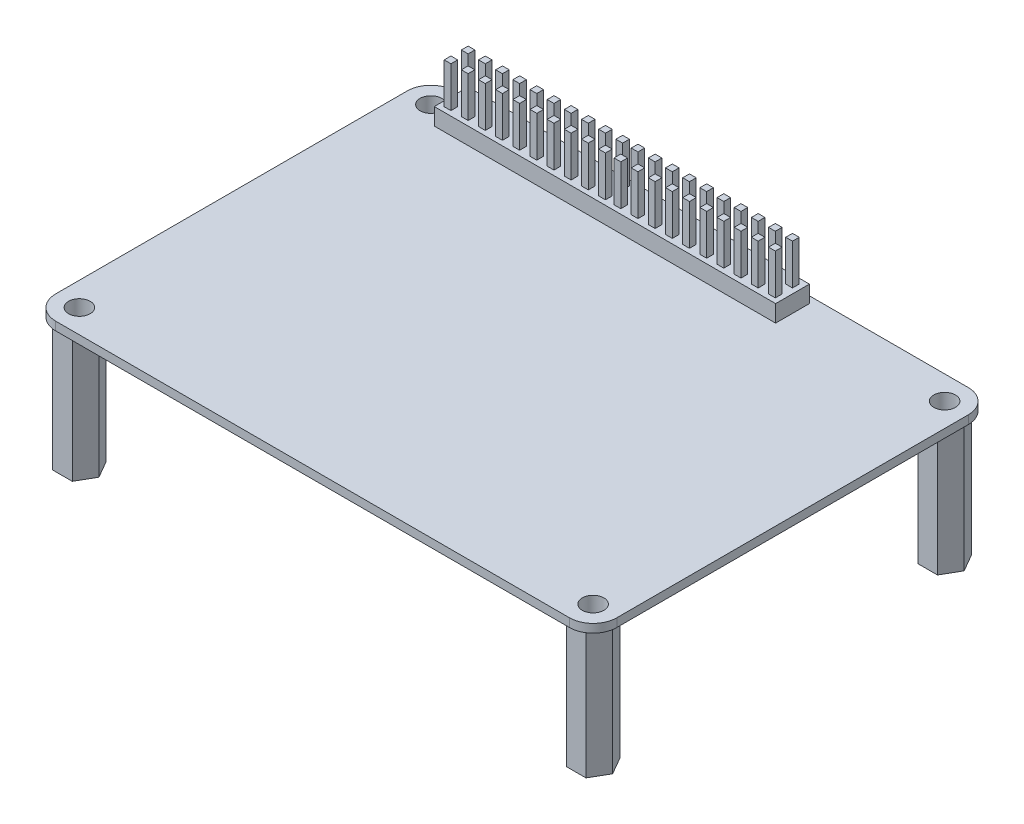
from build123d import *

# Parameters (mm, degrees)
ESQUISSE1_R        = 1.6
BOSS_EXTRU_1_DEPTH = 1.25
BOSS_EXTRU_2_START = 19.05
ESQUISSE2_R        = 1.6
BOSS_EXTRU_2_DEPTH = 19.05
ESQUISSE4_W        = 50.5
ESQUISSE4_H        = 5
BOSS_EXTRU_3_DEPTH = 2.5
ESQUISSE5_W        = 1
ESQUISSE5_H        = 1
BOSS_EXTRU_4_DEPTH = 6


with BuildPart() as part:
    # Esquisse1 → Boss.-Extru.1 (new body)
    with BuildSketch(Plane(origin=(0, 0, 0), x_dir=(1, 0, 0), z_dir=(0, 1, 0))):
        with BuildLine():
            Line((-38, -29.5), (38, -29.5))
            ThreePointArc((38, -29.5), (40.474873734, -28.474873734), (41.5, -26))
            Line((41.5, -26), (41.5, 26))
            ThreePointArc((41.5, 26), (40.474873734, 28.474873734), (38, 29.5))
            Line((38, 29.5), (-38, 29.5))
            ThreePointArc((-38, 29.5), (-40.474873734, 28.474873734), (-41.5, 26))
            Line((-41.5, 26), (-41.5, -26))
            ThreePointArc((-41.5, -26), (-40.474873734, -28.474873734), (-38, -29.5))
        make_face()
        with Locations((38, 26)):
            Circle(ESQUISSE1_R, mode=Mode.SUBTRACT)
        with Locations((38, -26)):
            Circle(ESQUISSE1_R, mode=Mode.SUBTRACT)
        with Locations((-38, 26)):
            Circle(ESQUISSE1_R, mode=Mode.SUBTRACT)
        with Locations((-38, -26)):
            Circle(ESQUISSE1_R, mode=Mode.SUBTRACT)
    extrude(amount=BOSS_EXTRU_1_DEPTH)

    # Esquisse2 → Boss.-Extru.2 (add)
    # profile 1 of 4: a face of its own
    with BuildSketch(Plane.XZ.offset(BOSS_EXTRU_2_START)):
        Polygon((-36.556624327, 28.5), (-39.443375673, 28.5), (-40.886751346, 26), (-39.443375673, 23.5), (-36.556624327, 23.5), (-35.113248654, 26), align=None)
        with Locations((-38, 26)):
            Circle(ESQUISSE2_R, mode=Mode.SUBTRACT)
    # profile 2 of 4: a face of its own
    with BuildSketch(Plane.XZ.offset(BOSS_EXTRU_2_START)):
        Polygon((-36.556624327, -23.5), (-39.443375673, -23.5), (-40.886751346, -26), (-39.443375673, -28.5), (-36.556624327, -28.5), (-35.113248654, -26), align=None)
        with Locations((-38, -26)):
            Circle(ESQUISSE2_R, mode=Mode.SUBTRACT)
    # profile 3 of 4: a face of its own
    with BuildSketch(Plane.XZ.offset(BOSS_EXTRU_2_START)):
        Polygon((39.443375673, -23.5), (36.556624327, -23.5), (35.113248654, -26), (36.556624327, -28.5), (39.443375673, -28.5), (40.886751346, -26), align=None)
        with Locations((38, -26)):
            Circle(ESQUISSE2_R, mode=Mode.SUBTRACT)
    # profile 4 of 4: a face of its own
    with BuildSketch(Plane.XZ.offset(BOSS_EXTRU_2_START)):
        Polygon((36.556624327, 23.5), (39.443375673, 23.5), (40.886751346, 26), (39.443375673, 28.5), (36.556624327, 28.5), (35.113248654, 26), align=None)
        with Locations((38, 26)):
            Circle(ESQUISSE2_R, mode=Mode.SUBTRACT)
    extrude(amount=-BOSS_EXTRU_2_DEPTH)

    # Esquisse4 → Boss.-Extru.3 (add)
    with BuildSketch(Plane(origin=(0, 1.25, 0), x_dir=(1, 0, 0), z_dir=(0, 1, 0))):
        with Locations((-9.75, 26)):
            Rectangle(ESQUISSE4_W, ESQUISSE4_H)
    extrude(amount=BOSS_EXTRU_3_DEPTH)

    # Esquisse5 → Boss.-Extru.4 (add)
    with BuildSketch(Plane(origin=(0, 3.75, 0), x_dir=(1, 0, 0), z_dir=(0, 1, 0))):
        with Locations((14.245, 27.25)):
            Rectangle(ESQUISSE5_W, ESQUISSE5_H)
        with Locations((-10.885, 27.25)):
            Rectangle(ESQUISSE5_W, ESQUISSE5_H)
        with Locations((-13.425, 27.25)):
            Rectangle(ESQUISSE5_W, ESQUISSE5_H)
        with Locations((-15.965, 27.25)):
            Rectangle(ESQUISSE5_W, ESQUISSE5_H)
        with Locations((-18.505, 27.25)):
            Rectangle(ESQUISSE5_W, ESQUISSE5_H)
        with Locations((-21.045, 27.25)):
            Rectangle(ESQUISSE5_W, ESQUISSE5_H)
        with Locations((-23.585, 27.25)):
            Rectangle(ESQUISSE5_W, ESQUISSE5_H)
        with Locations((-26.125, 27.25)):
            Rectangle(ESQUISSE5_W, ESQUISSE5_H)
        with Locations((-28.665, 27.25)):
            Rectangle(ESQUISSE5_W, ESQUISSE5_H)
        with Locations((-31.205, 27.25)):
            Rectangle(ESQUISSE5_W, ESQUISSE5_H)
        with Locations((-33.745, 27.25)):
            Rectangle(ESQUISSE5_W, ESQUISSE5_H)
        with Locations((11.705, 27.25)):
            Rectangle(ESQUISSE5_W, ESQUISSE5_H)
        with Locations((9.165, 27.25)):
            Rectangle(ESQUISSE5_W, ESQUISSE5_H)
        with Locations((6.625, 27.25)):
            Rectangle(ESQUISSE5_W, ESQUISSE5_H)
        with Locations((4.085, 27.25)):
            Rectangle(ESQUISSE5_W, ESQUISSE5_H)
        with Locations((1.545, 27.25)):
            Rectangle(ESQUISSE5_W, ESQUISSE5_H)
        with Locations((-0.995, 27.25)):
            Rectangle(ESQUISSE5_W, ESQUISSE5_H)
        with Locations((-3.535, 27.25)):
            Rectangle(ESQUISSE5_W, ESQUISSE5_H)
        with Locations((-6.075, 27.25)):
            Rectangle(ESQUISSE5_W, ESQUISSE5_H)
        with Locations((-8.615, 27.25)):
            Rectangle(ESQUISSE5_W, ESQUISSE5_H)
        with Locations((14.245, 24.71)):
            Rectangle(ESQUISSE5_W, ESQUISSE5_H)
        with Locations((-10.885, 24.71)):
            Rectangle(ESQUISSE5_W, ESQUISSE5_H)
        with Locations((-13.425, 24.71)):
            Rectangle(ESQUISSE5_W, ESQUISSE5_H)
        with Locations((-15.965, 24.71)):
            Rectangle(ESQUISSE5_W, ESQUISSE5_H)
        with Locations((-18.505, 24.71)):
            Rectangle(ESQUISSE5_W, ESQUISSE5_H)
        with Locations((-21.045, 24.71)):
            Rectangle(ESQUISSE5_W, ESQUISSE5_H)
        with Locations((-23.585, 24.71)):
            Rectangle(ESQUISSE5_W, ESQUISSE5_H)
        with Locations((-26.125, 24.71)):
            Rectangle(ESQUISSE5_W, ESQUISSE5_H)
        with Locations((-28.665, 24.71)):
            Rectangle(ESQUISSE5_W, ESQUISSE5_H)
        with Locations((-31.205, 24.71)):
            Rectangle(ESQUISSE5_W, ESQUISSE5_H)
        with Locations((-33.745, 24.71)):
            Rectangle(ESQUISSE5_W, ESQUISSE5_H)
        with Locations((11.705, 24.71)):
            Rectangle(ESQUISSE5_W, ESQUISSE5_H)
        with Locations((9.165, 24.71)):
            Rectangle(ESQUISSE5_W, ESQUISSE5_H)
        with Locations((6.625, 24.71)):
            Rectangle(ESQUISSE5_W, ESQUISSE5_H)
        with Locations((4.085, 24.71)):
            Rectangle(ESQUISSE5_W, ESQUISSE5_H)
        with Locations((1.545, 24.71)):
            Rectangle(ESQUISSE5_W, ESQUISSE5_H)
        with Locations((-0.995, 24.71)):
            Rectangle(ESQUISSE5_W, ESQUISSE5_H)
        with Locations((-3.535, 24.71)):
            Rectangle(ESQUISSE5_W, ESQUISSE5_H)
        with Locations((-6.075, 24.71)):
            Rectangle(ESQUISSE5_W, ESQUISSE5_H)
        with Locations((-8.615, 24.71)):
            Rectangle(ESQUISSE5_W, ESQUISSE5_H)
    extrude(amount=BOSS_EXTRU_4_DEPTH)


solid = part.part
